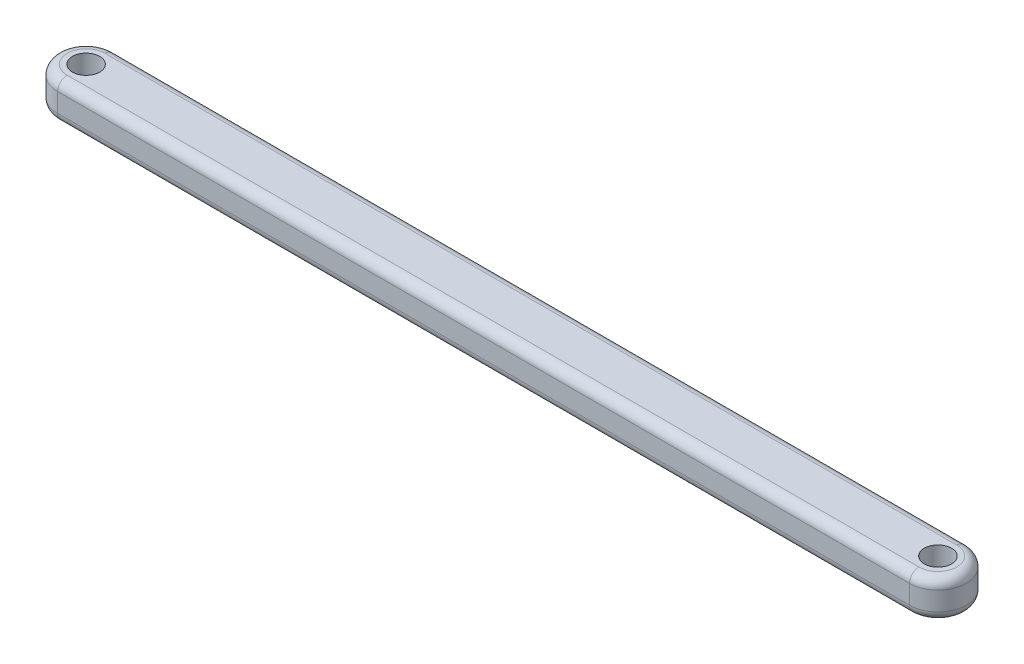
from build123d import *

# Parameters (mm, degrees)
BOSS_EXTRUDE1_DEPTH = 3.175
SKETCH2_R           = 2.286
CUT_EXTRUDE1_DEPTH  = 148.850719689
FILLET1_R           = 1.5875


with BuildPart() as part:
    # Sketch1 → Boss-Extrude1 (new, symmetric)
    with BuildSketch(Plane(origin=(0, 0, 0), x_dir=(1, 0, 0), z_dir=(0, 1, 0))):
        with BuildLine():
            Line((0, 4.7625), (142.875, 4.7625))
            ThreePointArc((142.875, 4.7625), (147.6375, 0), (142.875, -4.7625))
            Line((142.875, -4.7625), (0, -4.7625))
            ThreePointArc((0, -4.7625), (-4.7625, 0), (0, 4.7625))
        make_face()
    extrude(amount=BOSS_EXTRUDE1_DEPTH, both=True)

    # Sketch2 → Cut-Extrude1 (cut, through all)
    with BuildSketch(Plane(origin=(0, 3.175, 0), x_dir=(1, 0, 0), z_dir=(0, 1, 0))):
        Circle(SKETCH2_R)
        with Locations((142.875, 0)):
            Circle(SKETCH2_R)
    extrude(amount=-CUT_EXTRUDE1_DEPTH, mode=Mode.SUBTRACT)

    # Fillet1
    fillet1_edges = [part.edges().sort_by_distance(p)[0] for p in [
        (147.6375, -3.175, 0),
        (71.4375, -3.175, 4.7625),
        (-4.7625, -3.175, 0),
        (147.6375, 3.175, 0),
        (71.4375, 3.175, 4.7625),
        (-4.7625, 3.175, 0),
        (71.4375, -3.175, -4.7625),
        (71.4375, 3.175, -4.7625),
    ]]
    fillet(fillet1_edges, radius=FILLET1_R)


solid = part.part
